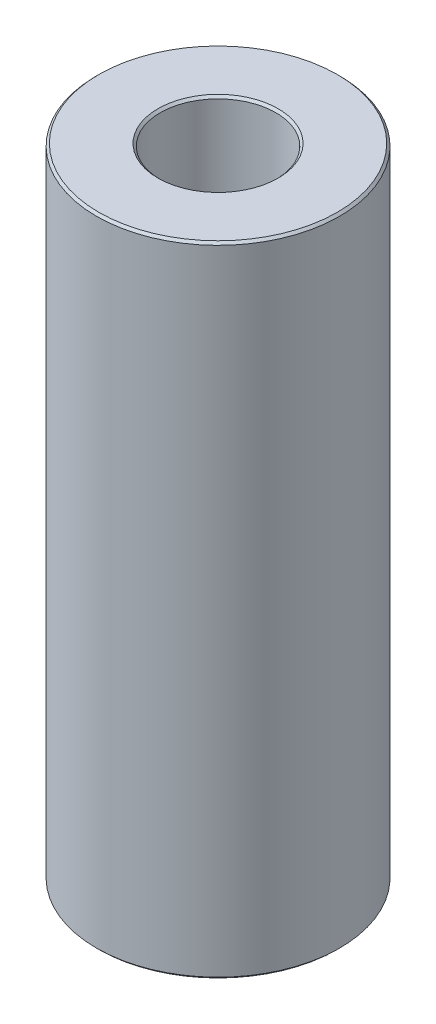
from build123d import *

# Parameters (mm, degrees)
SKETCH1_R           = 42.5
BOSS_EXTRUDE1_DEPTH = 223.140577603
SKETCH2_R           = 20.213562161
CUT_EXTRUDE1_DEPTH  = 232.093525164
CHAMFER1_SIZE       = 0.808248225


with BuildPart() as part:
    # Sketch1 → Boss-Extrude1 (new body)
    with BuildSketch(Plane(origin=(0, 0, 0), x_dir=(1, 0, 0), z_dir=(0, 1, 0))):
        Circle(SKETCH1_R)
    extrude(amount=BOSS_EXTRUDE1_DEPTH)

    # Sketch2 → Cut-Extrude1 (cut, through all)
    with BuildSketch(Plane(origin=(0, 0, 0), x_dir=(1, 0, 0), z_dir=(0, 1, 0))):
        Circle(SKETCH2_R)
    extrude(amount=CUT_EXTRUDE1_DEPTH, mode=Mode.SUBTRACT)

    # Chamfer1
    chamfer1_edges = [part.edges().sort_by_distance(p)[0] for p in [
        (-20.213562161, 223.140577603, 0),
        (-20.213562161, 0, 0),
        (-42.5, 0, 0),
        (-42.5, 223.140577603, 0),
    ]]
    chamfer(chamfer1_edges, length=CHAMFER1_SIZE)


solid = part.part
